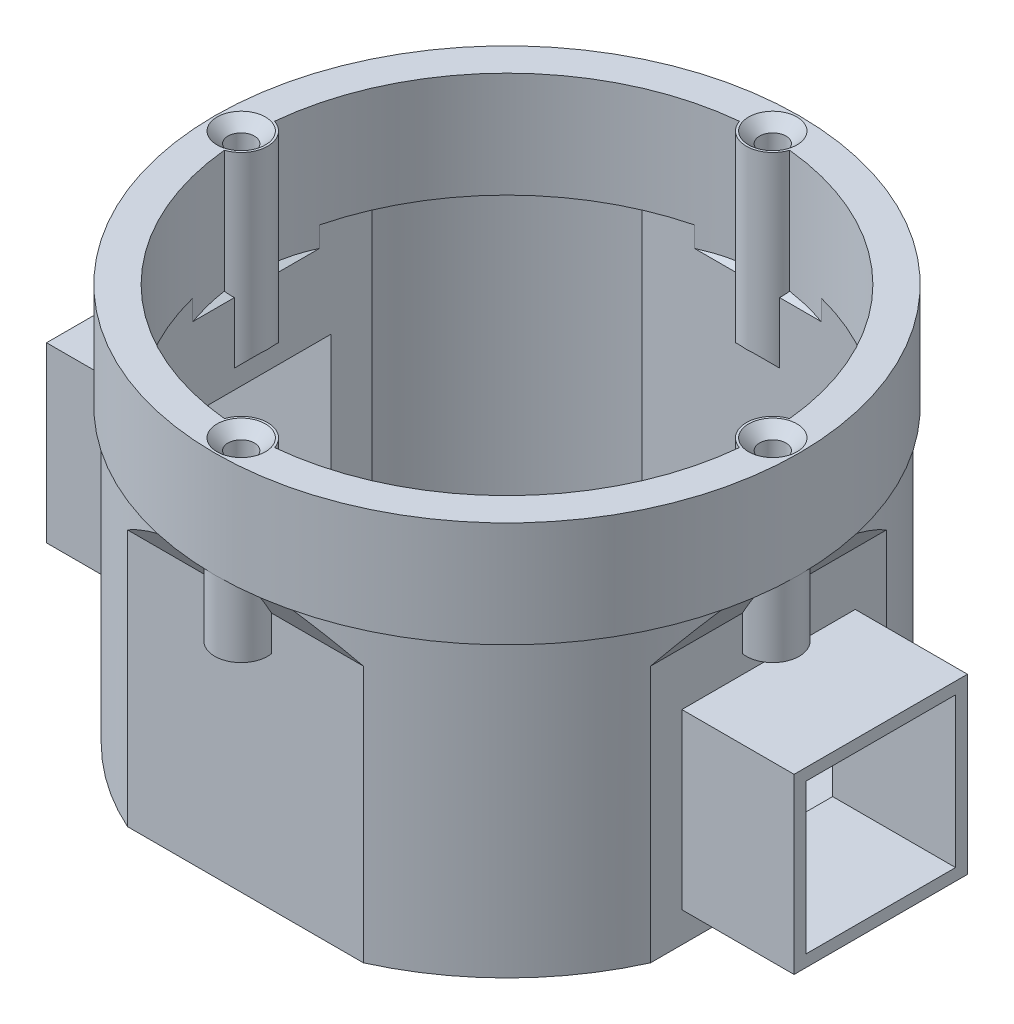
from build123d import *

# Parameters (mm, degrees)
EXTRUDE_THIN1_DEPTH     = 32
SKETCH2_R               = 33.2
SKETCH2_R_2             = 29.4
BOSS_EXTRUDE1_DEPTH     = 12
CHAMFER1_SIZE           = 4
CHAMFER1_SIZE_2         = 2.309401077
SKETCH3_R               = 3
BOSS_EXTRUDE2_DEPTH     = 20
CHAMFER2_SIZE           = 1.25
SKETCH5_W               = 19.7
SKETCH5_H               = 19.7
BOSS_EXTRUDE3_DEPTH     = 12.75
CUT_EXTRUDE1_DEPTH      = 102.25731381
CUT_EXTRUDE1_DEPTH_BACK = 102.25731381
SKETCH6_W               = 17
SKETCH6_H               = 17
BOSS_EXTRUDE4_START     = 1.2
BOSS_EXTRUDE4_DEPTH     = 1.2
SKETCH8_R               = 1.5
CUT_EXTRUDE2_DEPTH      = 15
CHAMFER3_SIZE           = 1.25


with BuildPart() as part:
    # Sketch1 → Extrude-Thin1 (new body)
    with BuildSketch(Plane(origin=(0, 0, 0), x_dir=(1, 0, 0), z_dir=(0, 1, 0))):
        with BuildLine():
            Line((29.72, 13.402792694), (29.72, -13.402792694))
            ThreePointArc((29.72, -13.402792694), (23.053343055, -23.053343055), (13.402792694, -29.72))
            Line((13.402792694, -29.72), (-13.402792694, -29.72))
            ThreePointArc((-13.402792694, -29.72), (-23.053343055, -23.053343055), (-29.72, -13.402792694))
            Line((-29.72, -13.402792694), (-29.72, 13.402792694))
            ThreePointArc((-29.72, 13.402792694), (-23.053343055, 23.053343055), (-13.402792694, 29.72))
            Line((-13.402792694, 29.72), (13.402792694, 29.72))
            ThreePointArc((13.402792694, 29.72), (23.053343055, 23.053343055), (29.72, 13.402792694))
        make_face()
        with BuildLine():
            Line((28.5, 13.137804878), (28.5, -13.137804878))
            ThreePointArc((28.5, -13.137804878), (22.190672782, -22.190672782), (13.137804878, -28.5))
            Line((13.137804878, -28.5), (-13.137804878, -28.5))
            ThreePointArc((-13.137804878, -28.5), (-22.190672782, -22.190672782), (-28.5, -13.137804878))
            Line((-28.5, -13.137804878), (-28.5, 13.137804878))
            ThreePointArc((-28.5, 13.137804878), (-22.190672782, 22.190672782), (-13.137804878, 28.5))
            Line((-13.137804878, 28.5), (13.137804878, 28.5))
            ThreePointArc((13.137804878, 28.5), (22.190672782, 22.190672782), (28.5, 13.137804878))
        make_face(mode=Mode.SUBTRACT)
    extrude(amount=EXTRUDE_THIN1_DEPTH)

    # Sketch2 → Boss-Extrude1 (add)
    with BuildSketch(Plane(origin=(0, 32, 0), x_dir=(1, 0, 0), z_dir=(0, 1, 0))):
        with Locations(Location((0, 0, 0), (0, 0, 270))):
            Circle(SKETCH2_R)
        with Locations(Location((0, 0, 0), (0, 0, 75.786553976))):
            Circle(SKETCH2_R_2, mode=Mode.SUBTRACT)
    extrude(amount=BOSS_EXTRUDE1_DEPTH)

    # Chamfer1
    # the kernel refuses this chamfer: 4, 2.309401077 mm, written as the material it adds along each edge
    with BuildSketch(Plane(origin=(-23.751135713, 32, -29.72), x_dir=(0, -0.9998132206222079, 0.01932676561270115), z_dir=(1, 0, 0))) as chamfer1_piece_1_section:
        Polygon((CHAMFER1_SIZE * 0.999813220622, CHAMFER1_SIZE * 0.0193267656127), (-CHAMFER1_SIZE_2 * 0.0193267656107, CHAMFER1_SIZE_2 * 0.999813220518), (0, 0), align=None)
    chamfer1_piece_1 = extrude(amount=47.502271426, mode=Mode.PRIVATE)
    chamfer1_piece_1 = chamfer1_piece_1 & Plane(origin=(0, 30.60321443, 0), x_dir=(0.41109897069605716, 0, -0.9115907175331714), z_dir=(0, -1, 0)) * Cylinder(32.602350406, 112, mode=Mode.PRIVATE)
    add(chamfer1_piece_1)
    with BuildSketch(Plane(origin=(-29.72, 32, 23.751135713), x_dir=(-0.9983227437537925, 0.05789386240267119, 0), z_dir=(0, 0, -1))) as chamfer1_piece_2_section:
        Polygon((CHAMFER1_SIZE_2 * 0.998322743649, -CHAMFER1_SIZE_2 * 0.0578938623966), (-CHAMFER1_SIZE * 0.0578938624027, -CHAMFER1_SIZE * 0.998322743754), (0, 0), align=None)
    chamfer1_piece_2 = extrude(amount=47.502271426, mode=Mode.PRIVATE)
    chamfer1_piece_2 = chamfer1_piece_2 & Plane(origin=(0, 30.60321443, 0), x_dir=(-0.9115907175331723, 0, -0.41109897069605533), z_dir=(0, -1, 0)) * Cylinder(32.602350406, 111, mode=Mode.PRIVATE)
    add(chamfer1_piece_2)
    with BuildSketch(Plane(origin=(23.751135713, 32, 29.72), x_dir=(0, 0.0578938624026711, 0.9983227437537925), z_dir=(-1, 0, 0))) as chamfer1_piece_3_section:
        Polygon((CHAMFER1_SIZE_2 * 0.998322743649, -CHAMFER1_SIZE_2 * 0.0578938623966), (-CHAMFER1_SIZE * 0.0578938624027, -CHAMFER1_SIZE * 0.998322743754), (0, 0), align=None)
    chamfer1_piece_3 = extrude(amount=47.502271426, mode=Mode.PRIVATE)
    chamfer1_piece_3 = chamfer1_piece_3 & Plane(origin=(0, 30.60321443, 0), x_dir=(0.9115907175331722, 0, 0.4110989706960556), z_dir=(0, -1, 0)) * Cylinder(32.602350406, 111, mode=Mode.PRIVATE)
    add(chamfer1_piece_3)
    with BuildSketch(Plane(origin=(29.72, 32, -23.751135713), x_dir=(-0.01932676561270115, -0.9998132206222079, 0), z_dir=(0, 0, 1))) as chamfer1_piece_4_section:
        Polygon((CHAMFER1_SIZE * 0.999813220622, CHAMFER1_SIZE * 0.0193267656127), (-CHAMFER1_SIZE_2 * 0.0193267656107, CHAMFER1_SIZE_2 * 0.999813220518), (0, 0), align=None)
    chamfer1_piece_4 = extrude(amount=47.502271426, mode=Mode.PRIVATE)
    chamfer1_piece_4 = chamfer1_piece_4 & Plane(origin=(0, 30.60321443, 0), x_dir=(0.41109897069605716, 0, -0.9115907175331714), z_dir=(0, -1, 0)) * Cylinder(32.602350406, 112, mode=Mode.PRIVATE)
    add(chamfer1_piece_4)
    # the kernel refuses this chamfer: 4, 2.309401077 mm, written as the material it takes off along each edge
    with BuildSketch(Plane(origin=(-17.567068668, 32, -28.5), x_dir=(0, 0.019326765612700306, -0.9998132206222079), z_dir=(1, 0, 0))) as chamfer1_2_piece_1_section:
        Polygon((CHAMFER1_SIZE * 0.999813220622, -CHAMFER1_SIZE * 0.0193267656127), (-CHAMFER1_SIZE_2 * 0.0193267656107, -CHAMFER1_SIZE_2 * 0.999813220518), (0, 0), align=None)
    chamfer1_2_piece_1 = extrude(amount=35.134137336, mode=Mode.PRIVATE)
    chamfer1_2_piece_1 = chamfer1_2_piece_1 & Plane(origin=(0, 30.944951594, 0), x_dir=(0.2455348860263091, 0, -0.9693877551032133), z_dir=(0, -1, 0)) * Cylinder(29.4, 87, mode=Mode.PRIVATE)
    add(chamfer1_2_piece_1, mode=Mode.SUBTRACT)
    with BuildSketch(Plane(origin=(17.567068668, 32, 28.5), x_dir=(0, 0.01932676561270029, 0.9998132206222079), z_dir=(-1, 0, 0))) as chamfer1_2_piece_2_section:
        Polygon((CHAMFER1_SIZE * 0.999813220622, -CHAMFER1_SIZE * 0.0193267656127), (-CHAMFER1_SIZE_2 * 0.0193267656107, -CHAMFER1_SIZE_2 * 0.999813220518), (0, 0), align=None)
    chamfer1_2_piece_2 = extrude(amount=35.134137336, mode=Mode.PRIVATE)
    chamfer1_2_piece_2 = chamfer1_2_piece_2 & Plane(origin=(0, 30.944951594, 0), x_dir=(0.2455348860263091, 0, -0.9693877551032133), z_dir=(0, -1, 0)) * Cylinder(29.4, 87, mode=Mode.PRIVATE)
    add(chamfer1_2_piece_2, mode=Mode.SUBTRACT)
    with BuildSketch(Plane(origin=(-28.5, 32, 17.567068668), x_dir=(-0.9998132206222079, 0.019326765612700306, 0), z_dir=(0, 0, -1))) as chamfer1_2_piece_3_section:
        Polygon((CHAMFER1_SIZE * 0.999813220622, -CHAMFER1_SIZE * 0.0193267656127), (-CHAMFER1_SIZE_2 * 0.0193267656107, -CHAMFER1_SIZE_2 * 0.999813220518), (0, 0), align=None)
    chamfer1_2_piece_3 = extrude(amount=35.134137336, mode=Mode.PRIVATE)
    chamfer1_2_piece_3 = chamfer1_2_piece_3 & Plane(origin=(0, 30.944951594, 0), x_dir=(0.2455348860263091, 0, -0.9693877551032133), z_dir=(0, -1, 0)) * Cylinder(29.4, 87, mode=Mode.PRIVATE)
    add(chamfer1_2_piece_3, mode=Mode.SUBTRACT)
    with BuildSketch(Plane(origin=(28.5, 32, -17.567068668), x_dir=(-0.0578938624026711, -0.9983227437537925, 0), z_dir=(0, 0, 1))) as chamfer1_2_piece_4_section:
        Polygon((CHAMFER1_SIZE_2 * 0.998322743649, CHAMFER1_SIZE_2 * 0.0578938623966), (-CHAMFER1_SIZE * 0.0578938624027, CHAMFER1_SIZE * 0.998322743754), (0, 0), align=None)
    chamfer1_2_piece_4 = extrude(amount=35.134137336, mode=Mode.PRIVATE)
    chamfer1_2_piece_4 = chamfer1_2_piece_4 & Plane(origin=(0, 30.944951594, 0), x_dir=(0.2455348860263091, 0, -0.9693877551032133), z_dir=(0, -1, 0)) * Cylinder(29.4, 87, mode=Mode.PRIVATE)
    add(chamfer1_2_piece_4, mode=Mode.SUBTRACT)

    # Sketch3 → Boss-Extrude2 (add)
    with BuildSketch(Plane(origin=(0, 44, 0), x_dir=(1, 0, 0), z_dir=(0, 1, 0))):
        with Locations((0, 30.2)):
            Circle(SKETCH3_R)
        with Locations((30.2, 0)):
            Circle(SKETCH3_R)
        with Locations((0, -30.2)):
            Circle(SKETCH3_R)
        with Locations((-30.2, 0)):
            Circle(SKETCH3_R)
    extrude(amount=-BOSS_EXTRUDE2_DEPTH)

    # Chamfer2
    chamfer2_edges = [part.edges().sort_by_distance(p)[0] for p in [
        (0, 24, -28.5),
        (28.5, 24, 0),
        (0, 24, 28.5),
        (-28.5, 24, 0),
    ]]
    chamfer(chamfer2_edges, length=CHAMFER2_SIZE)

    # Sketch5 → Boss-Extrude3 (add)
    with BuildSketch(Plane.ZY.offset(29.72)):
        with Locations((0, 12.1)):
            Rectangle(SKETCH5_W, SKETCH5_H)
    boss_extrude3 = extrude(amount=BOSS_EXTRUDE3_DEPTH)

    # Mirror1: Boss-Extrude3 across plane
    add(boss_extrude3.mirror(Plane(origin=(0, 0, 0), x_dir=(0, 0, 1), z_dir=(1, 0, 0))))

    # Sketch6 → Cut-Extrude1 (cut, two sides: drawn at the far end of the back side and taken through both)
    with BuildSketch(Plane.ZY.offset(42.47).offset(-CUT_EXTRUDE1_DEPTH_BACK)):
        with Locations((0, 12.1)):
            Rectangle(SKETCH6_W, SKETCH6_H)
    extrude(amount=CUT_EXTRUDE1_DEPTH + CUT_EXTRUDE1_DEPTH_BACK, mode=Mode.SUBTRACT)

    # Sketch7 → Boss-Extrude4 (add)
    with BuildSketch(Plane.XZ.offset(BOSS_EXTRUDE4_START)):
        with BuildLine():
            Line((29.72, -13.402792694), (29.72, 13.402792694))
            ThreePointArc((29.72, 13.402792694), (23.053343055, 23.053343055), (13.402792694, 29.72))
            Line((13.402792694, 29.72), (-13.402792694, 29.72))
            ThreePointArc((-13.402792694, 29.72), (-23.053343055, 23.053343055), (-29.72, 13.402792694))
            Line((-29.72, 13.402792694), (-29.72, -13.402792694))
            ThreePointArc((-29.72, -13.402792694), (-23.053343055, -23.053343055), (-13.402792694, -29.72))
            Line((-13.402792694, -29.72), (13.402792694, -29.72))
            ThreePointArc((13.402792694, -29.72), (23.053343055, -23.053343055), (29.72, -13.402792694))
        make_face()
    extrude(amount=-BOSS_EXTRUDE4_DEPTH)

    # Sketch8 → Cut-Extrude2 (cut)
    with BuildSketch(Plane(origin=(0, 44, 0), x_dir=(1, 0, 0), z_dir=(0, 1, 0))):
        with Locations(Location((0, 30.2, 0), (0, 0, 270))):
            Circle(SKETCH8_R)
        with Locations(Location((30.2, 0, 0), (0, 0, 270))):
            Circle(SKETCH8_R)
        with Locations(Location((0, -30.2, 0), (0, 0, 270))):
            Circle(SKETCH8_R)
        with Locations(Location((-30.2, 0, 0), (0, 0, 270))):
            Circle(SKETCH8_R)
    extrude(amount=-CUT_EXTRUDE2_DEPTH, mode=Mode.SUBTRACT)

    # Chamfer3
    chamfer3_edges = [part.edges().sort_by_distance(p)[0] for p in [
        (0, 44, -31.7),
        (30.2, 44, -1.5),
        (0, 44, 28.7),
        (-30.2, 44, -1.5),
    ]]
    chamfer(chamfer3_edges, length=CHAMFER3_SIZE)


solid = part.part
